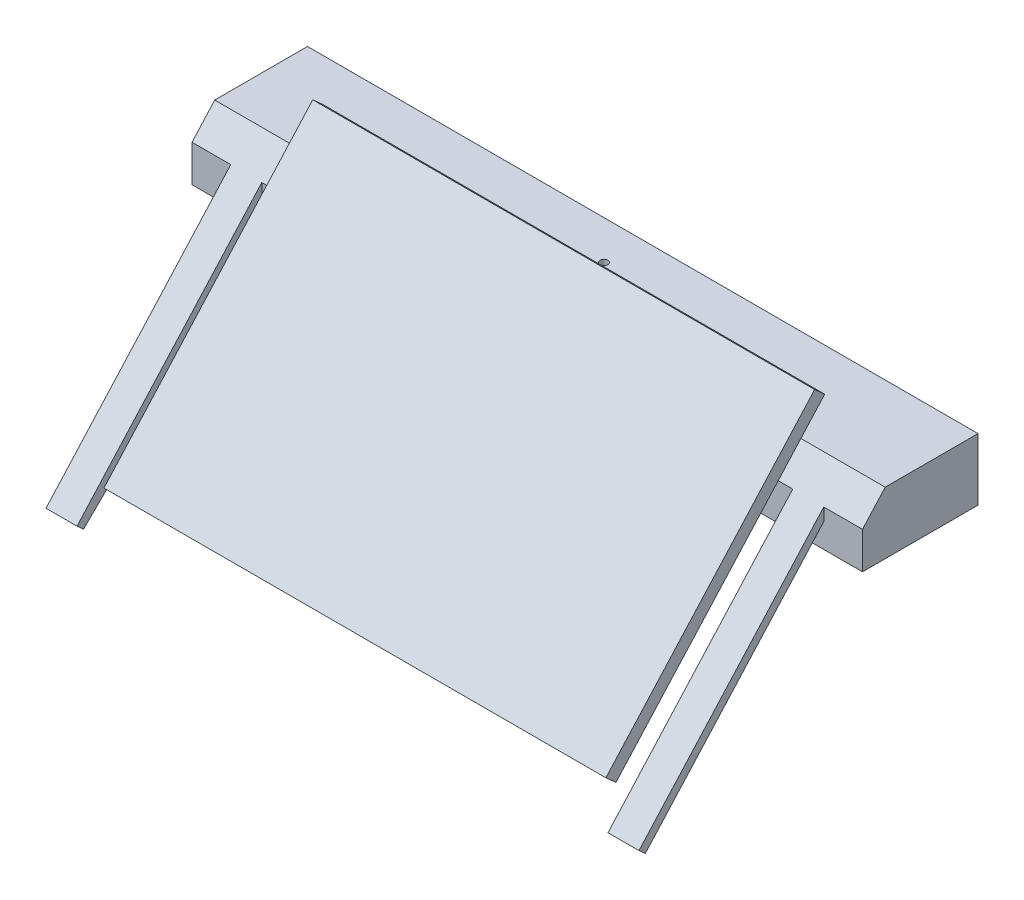
from build123d import *
from build123d.topology import SkipClean

# Parameters (mm, degrees)
SKETCH2_W               = 173
SKETCH2_H               = 29.8
BOSS_EXTRUDE1_DEPTH     = 14
SKETCH4_W               = 173
SKETCH4_H               = 29.8
SKETCH4_R               = 1
BOSS_EXTRUDE3_DEPTH     = 2
BOSS_EXTRUDE4_START     = 5.5
SKETCH5_R               = 1
BOSS_EXTRUDE4_DEPTH     = 5.5
CUT_EXTRUDE1_DEPTH      = 91.874033815
CUT_EXTRUDE1_DEPTH_BACK = 91.874033815
SKETCH7_W               = 129.5
SKETCH7_H               = 80.5
BOSS_EXTRUDE5_DEPTH     = 3.5
SKETCH8_W               = 8
SKETCH8_H               = 80
BOSS_EXTRUDE6_DEPTH     = 2.190926
CHAMFER1_START          = -76.5
CHAMFER1_DEPTH          = 8


with BuildPart() as part:
    # Sketch2 → Boss-Extrude1 (new body)
    with BuildSketch(Plane(origin=(0, 0, 0), x_dir=(1, 0, 0), z_dir=(0, 1, 0))):
        with Locations((0, 7.9)):
            Rectangle(SKETCH2_W, SKETCH2_H)
        with BuildLine():
            Line((-81.5, 0), (81.5, 0))
            add(Edge.make_bspline(
                [(-81.5, 0), (-74.436091259, 13.881927863), (-43.259356961, 16.362188276), (0, 18.555927536), (43.259356961, 16.362188276), (74.436091259, 13.881927863), (81.5, 0)],
                knots=[0, 0, 0, 0, 0.237125688, 0.5, 0.762874312, 1, 1, 1, 1], degree=3))
        make_face(mode=Mode.SUBTRACT)
    extrude(amount=BOSS_EXTRUDE1_DEPTH)

    # Sketch4 → Boss-Extrude3 (add)
    with BuildSketch(Plane(origin=(0, 14, 0), x_dir=(1, 0, 0), z_dir=(0, 1, 0))):
        with Locations((0, 7.9)):
            Rectangle(SKETCH4_W, SKETCH4_H)
        with Locations(Location((0, 12.8, 0), (0, 0, 270))):
            Circle(SKETCH4_R, mode=Mode.SUBTRACT)
    extrude(amount=BOSS_EXTRUDE3_DEPTH)

    # Sketch5 → Boss-Extrude4 (add)
    with SkipClean():  # the faces are left unmerged after this step: merging them gives an invalid solid
        with BuildSketch(Plane.XZ.offset(-14).offset(BOSS_EXTRUDE4_START)):
            Polygon((0, -9.8), (-7.931348641, -17.731348641), (-7.931348641, -22.8), (7.931348641, -22.8), (7.931348641, -17.731348641), align=None)
            with Locations(Location((0, -12.8, 0), (0, 0, 270))):
                Circle(SKETCH5_R, mode=Mode.SUBTRACT)
        extrude(amount=-BOSS_EXTRUDE4_DEPTH)

    # Sketch3 → Cut-Extrude1 (cut, two sides: drawn at the far end of the back side and taken through both)
    with SkipClean():  # the faces are left unmerged after this step: merging them gives an invalid solid
        with BuildSketch(Plane(origin=(0, 0, 0), x_dir=(0, 0, -1), z_dir=(1, 0, 0)).offset(-CUT_EXTRUDE1_DEPTH_BACK)):
            Polygon((-48.86878806, -37), (4.996225752, 22.823158451), (1.280501625, 26.168811483), (-52.584512187, -33.654346968), align=None)
        extrude(amount=CUT_EXTRUDE1_DEPTH + CUT_EXTRUDE1_DEPTH_BACK, mode=Mode.SUBTRACT)

    # Sketch8 → Boss-Extrude6 (add)
    with SkipClean():  # the faces are left unmerged after this step: merging them gives an invalid solid
        with BuildSketch(Plane(origin=(0, 7.734316433, 8.589828624), x_dir=(1, 0, 0), z_dir=(0, 0.669130606358862, 0.7431448254773908))):
            with Locations((-72.5, -28.87742566)):
                Rectangle(SKETCH8_W, SKETCH8_H)
            with Locations((72.5, -28.87742566)):
                Rectangle(SKETCH8_W, SKETCH8_H)
        extrude(amount=-BOSS_EXTRUDE6_DEPTH)

    # Chamfer1: read off the stored shape, not the designer's step
    # Chamfer1 outline → Chamfer1 (add)
    with SkipClean():  # the faces are left unmerged after this step: merging them gives an invalid solid
        with BuildSketch(Plane.YZ.offset(CHAMFER1_START)):
            Polygon((-44.917601714, 53.049646864), (-44.965963009, 52.995936205), (0.225712396, 7), (6.225712396, 7), align=None)
        extrude(amount=CHAMFER1_DEPTH)


with BuildPart() as body_2:
    # Sketch7 → Boss-Extrude5 (new body)
    with BuildSketch(Plane(origin=(0, 7.734316433, 8.589828624), x_dir=(1, 0, 0), z_dir=(0, 0.6691306063588622, 0.7431448254773908))):
        with Locations((0, -19.945960329)):
            Rectangle(SKETCH7_W, SKETCH7_H)
    extrude(amount=BOSS_EXTRUDE5_DEPTH)


solid = Compound([part.part, body_2.part])
